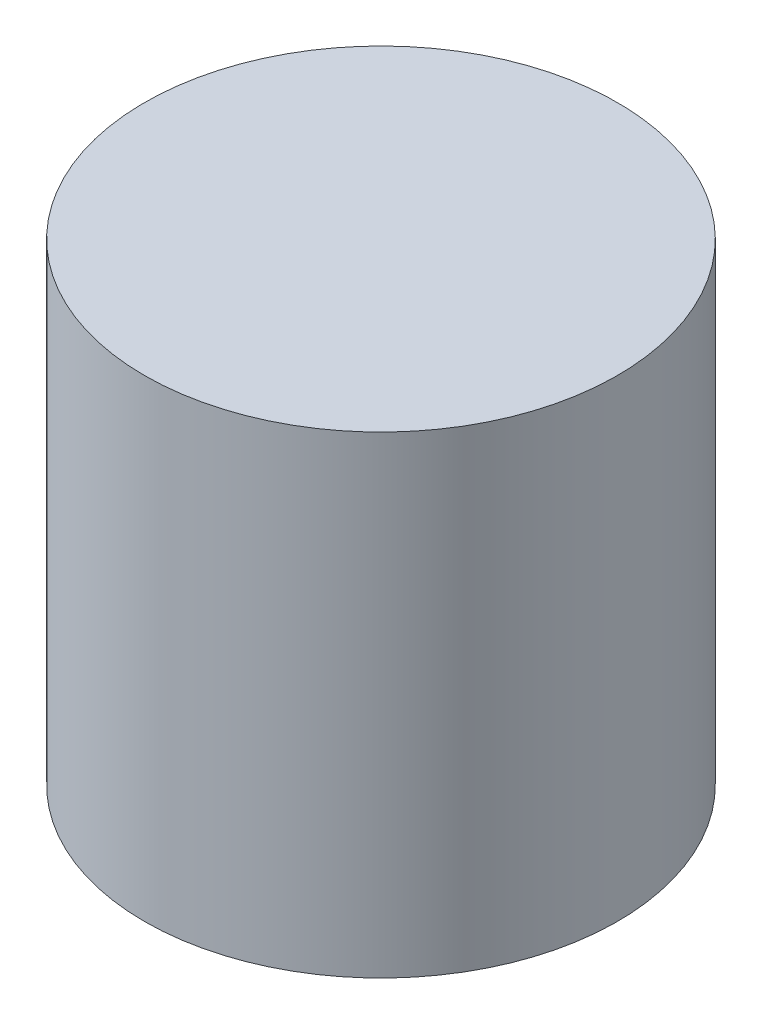
from build123d import *

# Parameters (mm, degrees)
SKETCH1_R           = 50
BOSS_EXTRUDE1_DEPTH = 100


with BuildPart() as part:
    # Sketch1 → Boss-Extrude1 (new body)
    with BuildSketch(Plane(origin=(0, 0, 0), x_dir=(1, 0, 0), z_dir=(0, 1, 0))):
        Circle(SKETCH1_R)
    extrude(amount=BOSS_EXTRUDE1_DEPTH)


solid = part.part
